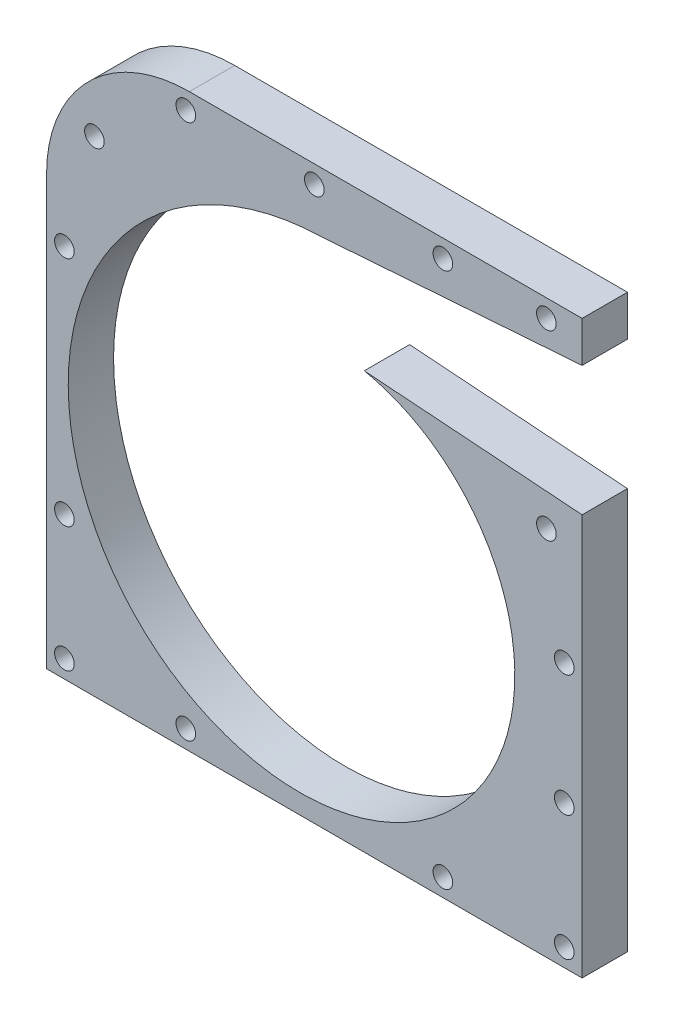
from build123d import *

# Parameters (mm, degrees)
SKETCH1_W           = 150
SKETCH1_H           = 160
BOSS_EXTRUDE1_DEPTH = 12.7
CUT_EXTRUDE2_REACH  = 203.761
SKETCH2_R           = 50
CUT_EXTRUDE3_REACH  = 203.761
FILLET1_R           = 40
CUT_EXTRUDE4_REACH  = 203.761
SKETCH9_R           = 2.75


with BuildPart() as part:
    # Sketch1 → Boss-Extrude1 (new body)
    with BuildSketch(Plane.XY):
        with Locations((56.818174671, 72.21769967)):
            Rectangle(SKETCH1_W, SKETCH1_H)
    extrude(amount=BOSS_EXTRUDE1_DEPTH)

    # Sketch2 → Cut-Extrude2 (cut, up to next)
    with BuildSketch(Plane.XY, mode=Mode.PRIVATE) as cut_extrude2_sk1:
        with Locations((56.818174671, 60.21769967)):
            Circle(SKETCH2_R)
    cut_extrude2_tool1 = extrude(cut_extrude2_sk1.sketch, amount=CUT_EXTRUDE2_REACH, mode=Mode.PRIVATE) & part.part
    add(cut_extrude2_tool1.solids().sort_by_distance((56.818175, 60.2177, 0))[0], mode=Mode.SUBTRACT)

    # Sketch8 → Cut-Extrude3 (cut, up to next)
    with BuildSketch(Plane.XY.offset(12.7), mode=Mode.PRIVATE) as cut_extrude3_sk1:
        with BuildLine():
            Line((58.92140003, 135.514331195), (131.818174671, 140.809388743))
            Line((131.818174671, 140.809388743), (131.818174671, 104.578808843))
            Line((131.818174671, 104.578808843), (70.806770479, 109.001730739))
            add(Edge.make_bspline(
                [(70.806770479, 109.001730739), (73.942524714, 108.368884336), (77.04178439, 107.432911602), (83.051183235, 104.970960127), (85.961176799, 103.444994734), (91.479272622, 99.84171719), (94.08723275, 97.764446671), (98.896476379, 93.118835241), (101.097626722, 90.550563372), (105.000601765, 85.003178114), (106.702307564, 82.024159237), (109.529682116, 75.752999351), (110.655251092, 72.460975365), (112.272876974, 65.675829551), (112.764857474, 62.18284337), (113.079726502, 55.118296179), (112.902565452, 51.546884758), (111.867369097, 44.454211174), (111.009313557, 40.93310722), (108.625399649, 34.071335338), (107.099551849, 30.730828472), (103.418128221, 24.357288168), (101.262594088, 21.324412639), (96.384092178, 15.685114778), (93.661196375, 13.078841183), (87.732775622, 8.399046081), (84.527350913, 6.325658336), (77.738594716, 2.80099297), (74.155388616, 1.34982877), (66.732312128, -0.861700607), (62.892588137, -1.621977418), (55.090144524, -2.406756839), (51.127587291, -2.431200011), (43.220919756, -1.725282069), (39.276982107, -0.994893308), (31.551721516, 1.212456983), (27.77057526, 2.689412638), (20.512525514, 6.354071351), (17.035796228, 8.541734506), (10.520379708, 13.56507488), (7.481857639, 16.400678926), (1.963709861, 22.631960147), (-0.515766072, 26.027532897), (-4.812661012, 33.268276111), (-6.629951535, 37.113314132), (-9.521205366, 45.123544829), (-10.595066712, 49.288581387), (-11.94355863, 57.794744944), (-12.218118102, 62.135697466), (-11.940081486, 70.8399882), (-11.387448434, 75.203139684), (-9.456713485, 83.793925735), (-8.078610826, 88.021368007), (-4.52880765, 96.184347178), (-2.357143331, 100.119693237), (2.718257783, 107.549380476), (5.621922023, 111.043539373), (12.071778181, 117.454666429), (15.617863156, 120.371467783), (23.237698029, 125.509870744), (27.311309881, 127.731327501), (35.849706709, 131.383908814), (40.314327037, 132.814916259), (49.481179121, 134.818294383), (54.183225201, 135.390580553), (58.92140003, 135.514331195)],
                knots=[0, 0, 0, 0, 0.03125, 0.03125, 0.0625, 0.0625, 0.09375, 0.09375, 0.125, 0.125, 0.15625, 0.15625, 0.1875, 0.1875, 0.21875, 0.21875, 0.25, 0.25, 0.28125, 0.28125, 0.3125, 0.3125, 0.34375, 0.34375, 0.375, 0.375, 0.40625, 0.40625, 0.4375, 0.4375, 0.46875, 0.46875, 0.5, 0.5, 0.53125, 0.53125, 0.5625, 0.5625, 0.59375, 0.59375, 0.625, 0.625, 0.65625, 0.65625, 0.6875, 0.6875, 0.71875, 0.71875, 0.75, 0.75, 0.78125, 0.78125, 0.8125, 0.8125, 0.84375, 0.84375, 0.875, 0.875, 0.90625, 0.90625, 0.9375, 0.9375, 0.96875, 0.96875, 1, 1, 1, 1], degree=3))
        make_face()
    cut_extrude3_tool1 = extrude(cut_extrude3_sk1.sketch, amount=-CUT_EXTRUDE3_REACH, mode=Mode.PRIVATE) & part.part
    add(cut_extrude3_tool1.solids().sort_by_distance((56.233786, 70.895416, 12.7))[0], mode=Mode.SUBTRACT)

    # Fillet1
    fillet1_edges = [part.edges().sort_by_distance(p)[0] for p in [
        (-18.181825329, 152.21769967, 6.35),
    ]]
    fillet(fillet1_edges, radius=FILLET1_R)

    # Sketch9 → Cut-Extrude4 (cut, up to next)
    with BuildSketch(Plane.XY.offset(12.7), mode=Mode.PRIVATE) as cut_extrude4_sk1:
        with Locations((121.818174671, 147.21769967)):
            Circle(SKETCH9_R)
    cut_extrude4_tool1 = extrude(cut_extrude4_sk1.sketch, amount=-CUT_EXTRUDE4_REACH, mode=Mode.PRIVATE) & part.part
    # Sketch9 → Cut-Extrude4 (cut, up to next)
    with BuildSketch(Plane.XY.offset(12.7), mode=Mode.PRIVATE) as cut_extrude4_sk2:
        with Locations((92.818174671, 147.21769967)):
            Circle(SKETCH9_R)
    cut_extrude4_tool2 = extrude(cut_extrude4_sk2.sketch, amount=-CUT_EXTRUDE4_REACH, mode=Mode.PRIVATE) & part.part
    # Sketch9 → Cut-Extrude4 (cut, up to next)
    with BuildSketch(Plane.XY.offset(12.7), mode=Mode.PRIVATE) as cut_extrude4_sk3:
        with Locations((56.818174671, 147.21769967)):
            Circle(SKETCH9_R)
    cut_extrude4_tool3 = extrude(cut_extrude4_sk3.sketch, amount=-CUT_EXTRUDE4_REACH, mode=Mode.PRIVATE) & part.part
    # Sketch9 → Cut-Extrude4 (cut, up to next)
    with BuildSketch(Plane.XY.offset(12.7), mode=Mode.PRIVATE) as cut_extrude4_sk4:
        with Locations((20.818174671, 147.21769967)):
            Circle(SKETCH9_R)
    cut_extrude4_tool4 = extrude(cut_extrude4_sk4.sketch, amount=-CUT_EXTRUDE4_REACH, mode=Mode.PRIVATE) & part.part
    # Sketch9 → Cut-Extrude4 (cut, up to next)
    with BuildSketch(Plane.XY.offset(12.7), mode=Mode.PRIVATE) as cut_extrude4_sk5:
        with Locations((-4.774596198, 128.093555907)):
            Circle(SKETCH9_R)
    cut_extrude4_tool5 = extrude(cut_extrude4_sk5.sketch, amount=-CUT_EXTRUDE4_REACH, mode=Mode.PRIVATE) & part.part
    # Sketch9 → Cut-Extrude4 (cut, up to next)
    with BuildSketch(Plane.XY.offset(12.7), mode=Mode.PRIVATE) as cut_extrude4_sk6:
        with Locations((-13.181825329, 97.21769967)):
            Circle(SKETCH9_R)
    cut_extrude4_tool6 = extrude(cut_extrude4_sk6.sketch, amount=-CUT_EXTRUDE4_REACH, mode=Mode.PRIVATE) & part.part
    # Sketch9 → Cut-Extrude4 (cut, up to next)
    with BuildSketch(Plane.XY.offset(12.7), mode=Mode.PRIVATE) as cut_extrude4_sk7:
        with Locations((-13.181825329, 32.21769967)):
            Circle(SKETCH9_R)
    cut_extrude4_tool7 = extrude(cut_extrude4_sk7.sketch, amount=-CUT_EXTRUDE4_REACH, mode=Mode.PRIVATE) & part.part
    # Sketch9 → Cut-Extrude4 (cut, up to next)
    with BuildSketch(Plane.XY.offset(12.7), mode=Mode.PRIVATE) as cut_extrude4_sk8:
        with Locations((-13.181825329, -2.78230033)):
            Circle(SKETCH9_R)
    cut_extrude4_tool8 = extrude(cut_extrude4_sk8.sketch, amount=-CUT_EXTRUDE4_REACH, mode=Mode.PRIVATE) & part.part
    # Sketch9 → Cut-Extrude4 (cut, up to next)
    with BuildSketch(Plane.XY.offset(12.7), mode=Mode.PRIVATE) as cut_extrude4_sk9:
        with Locations((20.818174671, -2.78230033)):
            Circle(SKETCH9_R)
    cut_extrude4_tool9 = extrude(cut_extrude4_sk9.sketch, amount=-CUT_EXTRUDE4_REACH, mode=Mode.PRIVATE) & part.part
    # Sketch9 → Cut-Extrude4 (cut, up to next)
    with BuildSketch(Plane.XY.offset(12.7), mode=Mode.PRIVATE) as cut_extrude4_sk10:
        with Locations((92.818174671, -2.78230033)):
            Circle(SKETCH9_R)
    cut_extrude4_tool10 = extrude(cut_extrude4_sk10.sketch, amount=-CUT_EXTRUDE4_REACH, mode=Mode.PRIVATE) & part.part
    # Sketch9 → Cut-Extrude4 (cut, up to next)
    with BuildSketch(Plane.XY.offset(12.7), mode=Mode.PRIVATE) as cut_extrude4_sk11:
        with Locations((126.818174671, -2.78230033)):
            Circle(SKETCH9_R)
    cut_extrude4_tool11 = extrude(cut_extrude4_sk11.sketch, amount=-CUT_EXTRUDE4_REACH, mode=Mode.PRIVATE) & part.part
    # Sketch9 → Cut-Extrude4 (cut, up to next)
    with BuildSketch(Plane.XY.offset(12.7), mode=Mode.PRIVATE) as cut_extrude4_sk12:
        with Locations((126.818174671, 32.21769967)):
            Circle(SKETCH9_R)
    cut_extrude4_tool12 = extrude(cut_extrude4_sk12.sketch, amount=-CUT_EXTRUDE4_REACH, mode=Mode.PRIVATE) & part.part
    # Sketch9 → Cut-Extrude4 (cut, up to next)
    with BuildSketch(Plane.XY.offset(12.7), mode=Mode.PRIVATE) as cut_extrude4_sk13:
        with Locations((126.818174671, 66.21769967)):
            Circle(SKETCH9_R)
    cut_extrude4_tool13 = extrude(cut_extrude4_sk13.sketch, amount=-CUT_EXTRUDE4_REACH, mode=Mode.PRIVATE) & part.part
    # Sketch9 → Cut-Extrude4 (cut, up to next)
    with BuildSketch(Plane.XY.offset(12.7), mode=Mode.PRIVATE) as cut_extrude4_sk14:
        with Locations((121.818174671, 96.21769967)):
            Circle(SKETCH9_R)
    cut_extrude4_tool14 = extrude(cut_extrude4_sk14.sketch, amount=-CUT_EXTRUDE4_REACH, mode=Mode.PRIVATE) & part.part
    add(cut_extrude4_tool1.solids().sort_by_distance((121.818175, 147.2177, 12.7))[0], mode=Mode.SUBTRACT)
    add(cut_extrude4_tool2.solids().sort_by_distance((92.818175, 147.2177, 12.7))[0], mode=Mode.SUBTRACT)
    add(cut_extrude4_tool3.solids().sort_by_distance((56.818175, 147.2177, 12.7))[0], mode=Mode.SUBTRACT)
    add(cut_extrude4_tool4.solids().sort_by_distance((20.818175, 147.2177, 12.7))[0], mode=Mode.SUBTRACT)
    add(cut_extrude4_tool5.solids().sort_by_distance((-4.774596, 128.093556, 12.7))[0], mode=Mode.SUBTRACT)
    add(cut_extrude4_tool6.solids().sort_by_distance((-13.181825, 97.2177, 12.7))[0], mode=Mode.SUBTRACT)
    add(cut_extrude4_tool7.solids().sort_by_distance((-13.181825, 32.2177, 12.7))[0], mode=Mode.SUBTRACT)
    add(cut_extrude4_tool8.solids().sort_by_distance((-13.181825, -2.7823, 12.7))[0], mode=Mode.SUBTRACT)
    add(cut_extrude4_tool9.solids().sort_by_distance((20.818175, -2.7823, 12.7))[0], mode=Mode.SUBTRACT)
    add(cut_extrude4_tool10.solids().sort_by_distance((92.818175, -2.7823, 12.7))[0], mode=Mode.SUBTRACT)
    add(cut_extrude4_tool11.solids().sort_by_distance((126.818175, -2.7823, 12.7))[0], mode=Mode.SUBTRACT)
    add(cut_extrude4_tool12.solids().sort_by_distance((126.818175, 32.2177, 12.7))[0], mode=Mode.SUBTRACT)
    add(cut_extrude4_tool13.solids().sort_by_distance((126.818175, 66.2177, 12.7))[0], mode=Mode.SUBTRACT)
    add(cut_extrude4_tool14.solids().sort_by_distance((121.818175, 96.2177, 12.7))[0], mode=Mode.SUBTRACT)


solid = part.part
